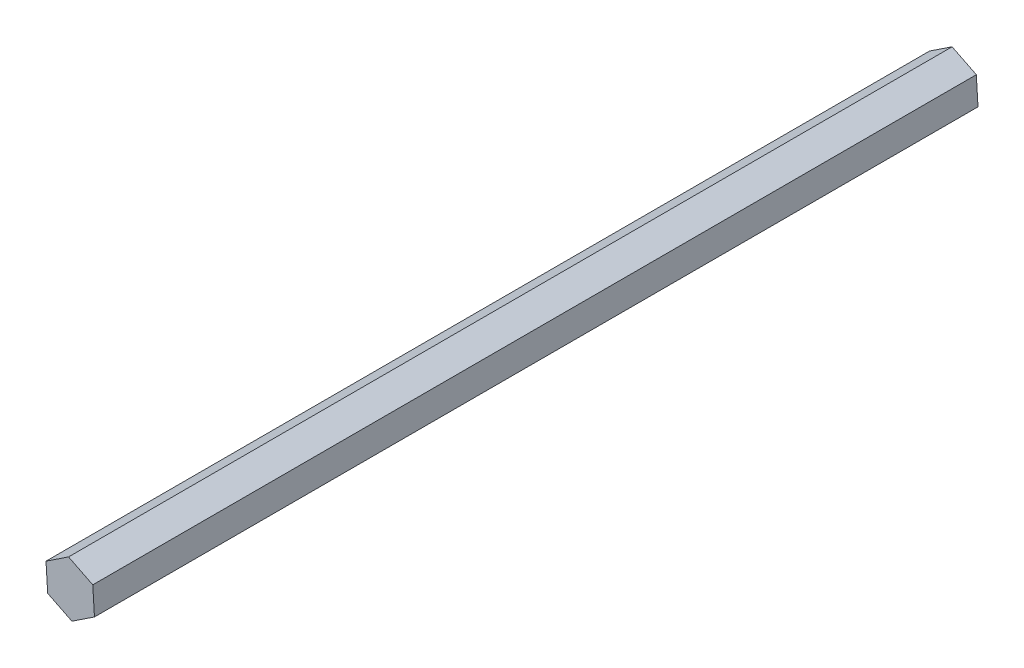
from build123d import *

# Parameters (mm, degrees)
BOSS_EXTRUDE1_DEPTH = 240


with BuildPart() as part:
    # Sketch1 → Boss-Extrude1 (new body)
    with BuildSketch(Plane.XY):
        Polygon((-0.45377191, 7.335979216), (-6.580030318, 3.275011606), (-6.126258407, -4.06096761), (0.45377191, -7.335979216), (6.580030318, -3.275011606), (6.126258407, 4.06096761), align=None)
    extrude(amount=BOSS_EXTRUDE1_DEPTH)


solid = part.part
